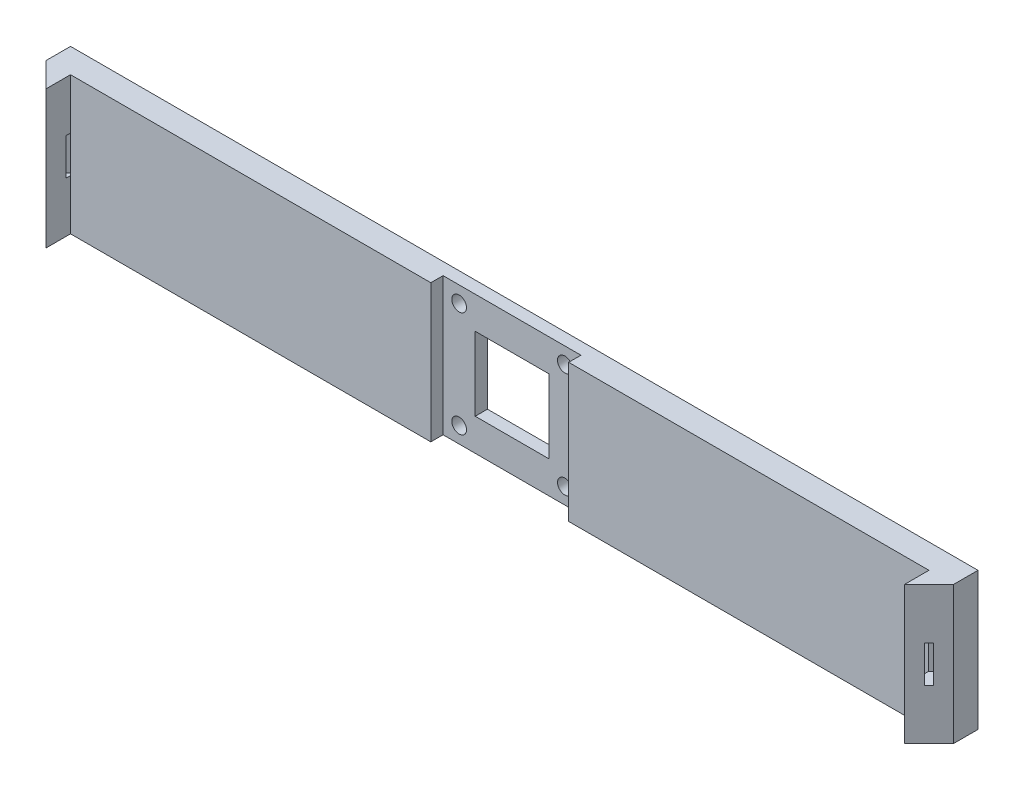
from build123d import *

# Parameters (mm, degrees)
SKETCH1_W           = 350
SKETCH1_H           = 56.2
BOSS_EXTRUDE1_DEPTH = 10
SKETCH2_W           = 56.2
SKETCH2_H           = 56.2
CUT_EXTRUDE1_DEPTH  = 5
SKETCH3_W           = 10
SKETCH3_H           = 56.2
BOSS_EXTRUDE2_DEPTH = 10
SKETCH4_W           = 10
SKETCH4_H           = 56.2
BOSS_EXTRUDE3_DEPTH = 10
CUT_EXTRUDE2_DEPTH  = 56.2
SKETCH6_W           = 10
SKETCH6_H           = 56.2
BOSS_EXTRUDE4_DEPTH = 10
SKETCH7_W           = 10
SKETCH7_H           = 56.2
BOSS_EXTRUDE5_DEPTH = 10
CUT_EXTRUDE3_DEPTH  = 56.2
SKETCH9_W           = 30
SKETCH9_H           = 30
CUT_EXTRUDE4_DEPTH  = 5
SKETCH10_R          = 3
CUT_EXTRUDE5_DEPTH  = 5
SKETCH11_W          = 2.5
SKETCH11_H          = 15
CUT_EXTRUDE6_DEPTH  = 7
SKETCH12_W          = 2.5
SKETCH12_H          = 15
CUT_EXTRUDE7_DEPTH  = 7


with BuildPart() as part:
    # Sketch1 → Boss-Extrude1 (new body)
    with BuildSketch(Plane.XY):
        Rectangle(SKETCH1_W, SKETCH1_H)
    extrude(amount=BOSS_EXTRUDE1_DEPTH)

    # Sketch2 → Cut-Extrude1 (cut)
    with BuildSketch(Plane.XY.offset(10)):
        Rectangle(SKETCH2_W, SKETCH2_H)
    extrude(amount=-CUT_EXTRUDE1_DEPTH, mode=Mode.SUBTRACT)

    # Sketch3 → Boss-Extrude2 (add)
    with BuildSketch(Plane(origin=(175, 0, 0), x_dir=(0, 0, -1), z_dir=(1, 0, 0))):
        with Locations((-5, 0)):
            Rectangle(SKETCH3_W, SKETCH3_H)
    extrude(amount=BOSS_EXTRUDE2_DEPTH)

    # Sketch4 → Boss-Extrude3 (add)
    with BuildSketch(Plane.XY.offset(10)):
        with Locations((180, 0)):
            Rectangle(SKETCH4_W, SKETCH4_H)
    extrude(amount=BOSS_EXTRUDE3_DEPTH)

    # Sketch5 → Cut-Extrude2 (cut)
    with BuildSketch(Plane(origin=(0, 28.1, 0), x_dir=(1, 0, 0), z_dir=(0, 1, 0))):
        Polygon((175, -20), (185, -10), (185, -20), align=None)
    extrude(amount=-CUT_EXTRUDE2_DEPTH, mode=Mode.SUBTRACT)

    # Sketch6 → Boss-Extrude4 (add)
    with BuildSketch(Plane.ZY.offset(175)):
        with Locations((5, 0)):
            Rectangle(SKETCH6_W, SKETCH6_H)
    extrude(amount=BOSS_EXTRUDE4_DEPTH)

    # Sketch7 → Boss-Extrude5 (add)
    with BuildSketch(Plane.XY.offset(10)):
        with Locations((-180, 0)):
            Rectangle(SKETCH7_W, SKETCH7_H)
    extrude(amount=BOSS_EXTRUDE5_DEPTH)

    # Sketch8 → Cut-Extrude3 (cut)
    with BuildSketch(Plane(origin=(0, 28.1, 0), x_dir=(1, 0, 0), z_dir=(0, 1, 0))):
        Polygon((-175, -20), (-185, -10), (-185, -20), align=None)
    extrude(amount=-CUT_EXTRUDE3_DEPTH, mode=Mode.SUBTRACT)

    # Sketch9 → Cut-Extrude4 (cut)
    with BuildSketch(Plane.XY.offset(5)):
        Rectangle(SKETCH9_W, SKETCH9_H)
    extrude(amount=-CUT_EXTRUDE4_DEPTH, mode=Mode.SUBTRACT)

    # Sketch10 → Cut-Extrude5 (cut)
    with BuildSketch(Plane.XY.offset(5)):
        with Locations((21.55, 21.55)):
            Circle(SKETCH10_R)
        with Locations((-21.55, -21.55)):
            Circle(SKETCH10_R)
        with Locations((-21.55, 21.55)):
            Circle(SKETCH10_R)
        with Locations((21.55, -21.55)):
            Circle(SKETCH10_R)
    extrude(amount=-CUT_EXTRUDE5_DEPTH, mode=Mode.SUBTRACT)

    # Sketch11 → Cut-Extrude6 (cut)
    with BuildSketch(Plane(origin=(97.5, 0, 97.5), x_dir=(0.7071067811865478, 0, -0.7071067811865472), z_dir=(0.7071067811865472, 0, 0.7071067811865478))):
        with Locations((116.672618896, 0)):
            Rectangle(SKETCH11_W, SKETCH11_H)
    extrude(amount=-CUT_EXTRUDE6_DEPTH, mode=Mode.SUBTRACT)

    # Sketch12 → Cut-Extrude7 (cut)
    with BuildSketch(Plane(origin=(-97.5, 0, 97.5), x_dir=(0.7071067811865478, 0, 0.7071067811865472), z_dir=(-0.7071067811865472, 0, 0.7071067811865478))):
        with Locations((-116.672618896, 0)):
            Rectangle(SKETCH12_W, SKETCH12_H)
    extrude(amount=-CUT_EXTRUDE7_DEPTH, mode=Mode.SUBTRACT)


solid = part.part
